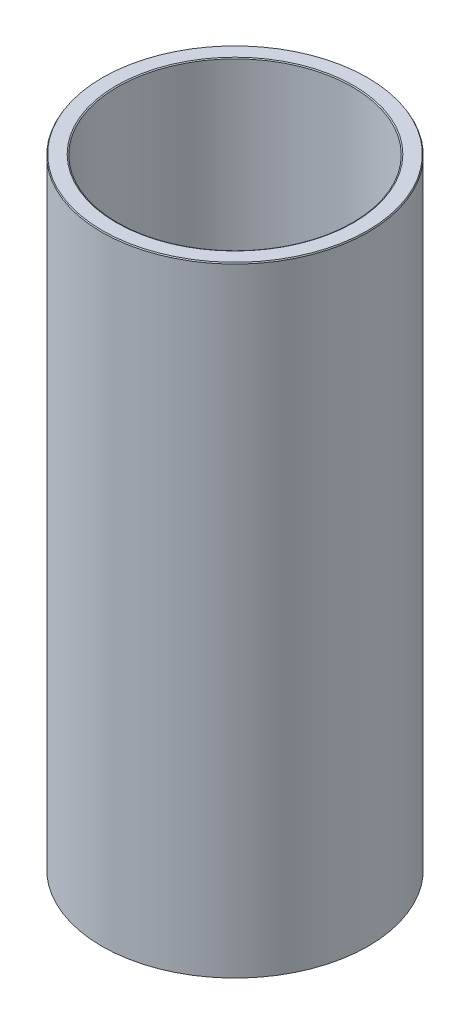
from build123d import *
from OCP.BRepFilletAPI import BRepFilletAPI_MakeChamfer

# Parameters (mm, degrees)
SKETCH1_R           = 40
BOSS_EXTRUDE1_DEPTH = 186.253668168
SKETCH2_R           = 35.314786821
CUT_EXTRUDE1_DEPTH  = 195.654640084
CHAMFER1_SIZE       = 0.336038019
CHAMFER1_SIZE2      = 0.194011641


with BuildPart() as part:
    # Sketch1 → Boss-Extrude1 (new body)
    with BuildSketch(Plane(origin=(0, 0, 0), x_dir=(1, 0, 0), z_dir=(0, 1, 0))):
        Circle(SKETCH1_R)
    extrude(amount=BOSS_EXTRUDE1_DEPTH)

    # Sketch2 → Cut-Extrude1 (cut, through all)
    with BuildSketch(Plane(origin=(0, 0, 0), x_dir=(1, 0, 0), z_dir=(0, 1, 0))):
        Circle(SKETCH2_R)
    extrude(amount=CUT_EXTRUDE1_DEPTH, mode=Mode.SUBTRACT)

    # Chamfer1: one chamfer whose edges measure the first distance from different faces: ONE call of the kernel's chamfer builder (chamfer() names one face for all edges)
    chamfer1_edges_1 = [part.edges().sort_by_distance(p)[0] for p in [
        (-35.314786821, 186.253668168, 0),
    ]]
    chamfer1_side_1 = [part.faces().sort_by_distance(p)[0] for p in [
        (-38.86862915, 186.253668168, 0),
    ]]
    chamfer1_edges_2 = [part.edges().sort_by_distance(p)[0] for p in [
        (-35.314786821, 0, 0),
    ]]
    chamfer1_side_2 = [part.faces().sort_by_distance(p)[0] for p in [
        (-35.314786821, 93.126834084, 0),
    ]]
    chamfer1_edges_3 = [part.edges().sort_by_distance(p)[0] for p in [
        (-40, 0, 0),
    ]]
    chamfer1_side_3 = [part.faces().sort_by_distance(p)[0] for p in [
        (-38.86862915, 0, 0),
    ]]
    chamfer1_edges_4 = [part.edges().sort_by_distance(p)[0] for p in [
        (-40, 186.253668168, 0),
    ]]
    chamfer1_side_4 = [part.faces().sort_by_distance(p)[0] for p in [
        (-40, 93.126834084, 0),
    ]]
    chamfer1 = BRepFilletAPI_MakeChamfer(part.part.solid().wrapped)
    for e in chamfer1_edges_1:
        chamfer1.Add(CHAMFER1_SIZE, CHAMFER1_SIZE2, e.wrapped, chamfer1_side_1[0].wrapped)  # the first distance lies on this face
    for e in chamfer1_edges_2:
        chamfer1.Add(CHAMFER1_SIZE, CHAMFER1_SIZE2, e.wrapped, chamfer1_side_2[0].wrapped)  # the first distance lies on this face
    for e in chamfer1_edges_3:
        chamfer1.Add(CHAMFER1_SIZE, CHAMFER1_SIZE2, e.wrapped, chamfer1_side_3[0].wrapped)  # the first distance lies on this face
    for e in chamfer1_edges_4:
        chamfer1.Add(CHAMFER1_SIZE, CHAMFER1_SIZE2, e.wrapped, chamfer1_side_4[0].wrapped)  # the first distance lies on this face
    add(Compound.cast(chamfer1.Shape()), mode=Mode.REPLACE)


solid = part.part
